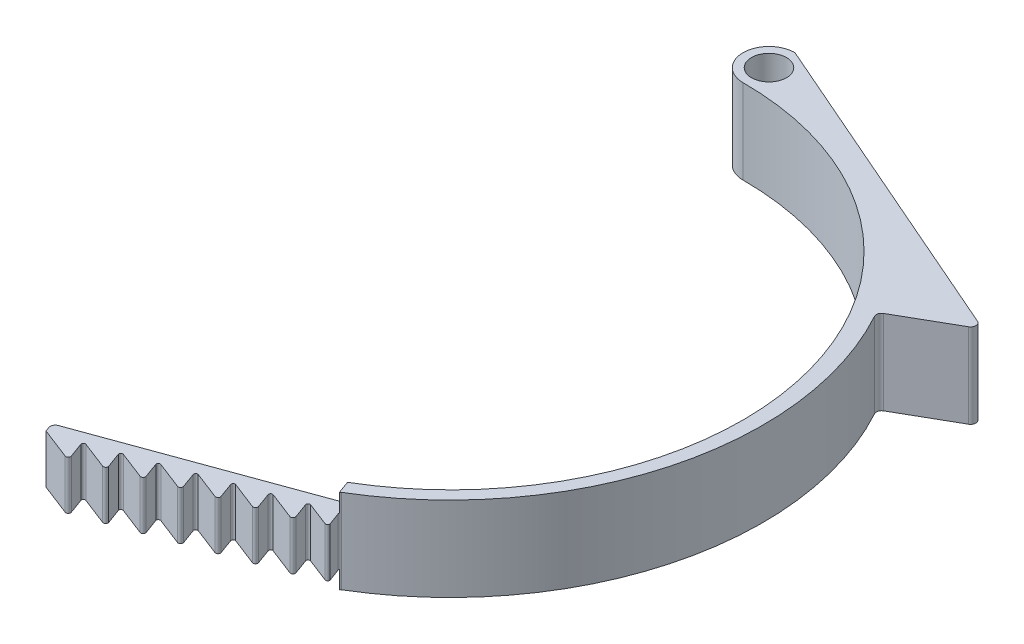
from build123d import *
from build123d.topology import SkipClean

# Parameters (mm, degrees)
BOSS_EXTRUDE1_DEPTH = 13
CUT_EXTRUDE3_DEPTH  = 77.831899265
FILLET1_R           = 0.8
LPATTERN1_DEPTH     = 13
FILLET2_R           = 0.363442
FILLET3_R           = 0.363442
FILLET4_R           = 0.363442
FILLET5_R           = 0.363442
FILLET6_R           = 0.363442
FILLET7_R           = 0.363442
FILLET8_R           = 0.363442
FILLET9_R           = 0.3
SKETCH3_OUTSIDE_W   = 148.316
SKETCH3_OUTSIDE_H   = 39.78
SKETCH3_OUTSIDE_W_2 = 5.910380326
SKETCH3_OUTSIDE_H_2 = 7.5
CUT_EXTRUDE2_DEPTH  = 35.5


# Read off the part's stored shape, not the designer's step: LPattern1
with BuildPart() as part:
    # Sketch1 → Boss-Extrude1 (new body)
    with BuildSketch(Plane(origin=(0, 0, 0), x_dir=(1, 0, 0), z_dir=(0, 1, 0))):
        with BuildLine():
            Line((0, 51.7), (0, 53))
            ThreePointArc((0, 53), (-4, 49), (0, 45))
            ThreePointArc((0, 45), (43.466662183, 11.64685703), (22.5, -38.97114317))
            Line((22.5, -38.97114317), (-10.482378388, -50.975747159))
            Line((-10.482378388, -50.975747159), (-8.772277672, -55.674210263))
            Line((-8.772277672, -55.674210263), (24.536452539, -43.550823925))
            Line((24.536452539, -43.550823925), (23.5, -40.703193978))
            ThreePointArc((23.5, -40.703193978), (45.592051892, -11.596446998), (40.913607467, 24.644050161))
            ThreePointArc((40.913607467, 24.644050161), (24.824872502, 41.52042314), (2.696847486, 48.869563675))
            ThreePointArc((2.696847486, 48.869563675), (-1.954760609, 47.137498735), (0, 51.7))
        make_face()
        with BuildLine():
            Line((51.327605208, 30.606319113), (0, 53))
            Line((0, 53), (0, 51.7))
            ThreePointArc((0, 51.7), (1.909188309, 50.909188309), (2.7, 49))
            ThreePointArc((2.7, 49), (2.699211757, 48.934762792), (2.696847486, 48.869563675))
            ThreePointArc((2.696847486, 48.869563675), (24.824872502, 41.52042314), (40.913607467, 24.644050161))
            Line((40.913607467, 24.644050161), (51.327605208, 30.606319113))
        make_face()
    extrude(amount=BOSS_EXTRUDE1_DEPTH)

    # Sketch2 → Cut-Extrude3 (cut, through all)
    with BuildSketch(Plane(origin=(0, 13, 0), x_dir=(1, 0, 0), z_dir=(0, 1, 0))):
        Polygon((-8.772277672, -55.674210263), (-9.969348173, -52.38528609), (-5.013507189, -54.30612969), align=None)
    extrude(amount=-CUT_EXTRUDE3_DEPTH, mode=Mode.SUBTRACT)

    # Fillet1
    fillet1_edges = [part.edges().sort_by_distance(p)[0] for p in [
        (51.327605208, 6.5, -30.606319113),
        (40.913607467, 6.5, -24.644050161),
        (-10.482378388, 6.5, 50.975747159),
        (0, 6.5, -53),
    ]]
    fillet(fillet1_edges, radius=FILLET1_R)

    # LPattern1 outline → LPattern1 (cut)
    with BuildSketch(Plane(origin=(0, 0, 0), x_dir=(1, 0, 0), z_dir=(0, 1, 0))):
        Polygon((-0.784890395, -52.767039045), (-5.74073138, -50.846195445), (-4.543660878, -54.135119618), align=None)
        Polygon((19.630969381, -41.611651575), (20.828039883, -44.900575748), (24.536452539, -43.550823925), (24.520414883, -43.506760826), align=None)
        Polygon((15.402352588, -43.15074222), (16.59942309, -46.439666393), (20.358193573, -45.07158582), align=None)
        Polygon((11.173735794, -44.689832865), (12.370806296, -47.978757038), (16.129576779, -46.610676465), align=None)
        Polygon((6.945119001, -46.22892351), (8.142189502, -49.517847683), (11.900959986, -48.14976711), align=None)
        Polygon((2.716502207, -47.768014155), (3.913572709, -51.056938328), (7.672343192, -49.688857755), align=None)
        Polygon((-1.512114586, -49.3071048), (-0.315044085, -52.596028973), (3.443726399, -51.2279484), align=None)
    extrude(amount=LPATTERN1_DEPTH, mode=Mode.SUBTRACT)

    # Fillet2
    fillet2_edges = [part.edges().sort_by_distance(p)[0] for p in [
        (-4.543660878, 6.5, 54.135119618),
        (-5.013507189, 6.5, 54.30612969),
    ]]
    fillet(fillet2_edges, radius=FILLET2_R)

    # Fillet3
    fillet3_edges = [part.edges().sort_by_distance(p)[0] for p in [
        (-0.315044085, 6.5, 52.596028973),
        (-0.784890395, 6.5, 52.767039045),
    ]]
    fillet(fillet3_edges, radius=FILLET3_R)

    # Fillet4
    fillet4_edges = [part.edges().sort_by_distance(p)[0] for p in [
        (3.443726399, 6.5, 51.2279484),
        (3.913572709, 6.5, 51.056938328),
    ]]
    fillet(fillet4_edges, radius=FILLET4_R)

    # Fillet5
    fillet5_edges = [part.edges().sort_by_distance(p)[0] for p in [
        (8.142189502, 6.5, 49.517847683),
        (7.672343192, 6.5, 49.688857755),
    ]]
    fillet(fillet5_edges, radius=FILLET5_R)

    # Fillet6
    fillet6_edges = [part.edges().sort_by_distance(p)[0] for p in [
        (11.900959986, 6.5, 48.14976711),
        (12.370806296, 6.5, 47.978757038),
    ]]
    fillet(fillet6_edges, radius=FILLET6_R)

    # Fillet7
    fillet7_edges = [part.edges().sort_by_distance(p)[0] for p in [
        (16.129576779, 6.5, 46.610676465),
        (16.59942309, 6.5, 46.439666393),
    ]]
    fillet(fillet7_edges, radius=FILLET7_R)

    # Fillet8
    fillet8_edges = [part.edges().sort_by_distance(p)[0] for p in [
        (20.828039883, 6.5, 44.900575748),
        (20.358193573, 6.5, 45.07158582),
    ]]
    fillet(fillet8_edges, radius=FILLET8_R)

    # Fillet9
    fillet9_edges = [part.edges().sort_by_distance(p)[0] for p in [
        (6.945119001, 6.5, 46.22892351),
        (11.173735794, 6.5, 44.689832865),
        (-1.512114586, 6.5, 49.3071048),
        (2.716502207, 6.5, 47.768014155),
        (24.520414883, 6.5, 43.506760826),
        (19.630969381, 6.5, 41.611651575),
        (15.402352588, 6.5, 43.15074222),
        (-5.74073138, 6.5, 50.846195445),
        (23.5, 6.5, 40.703193978),
    ]]
    fillet(fillet9_edges, radius=FILLET9_R)

    # Sketch3 outside → Cut-Extrude2 (cut)
    with SkipClean():  # the faces are left unmerged after this step: merging them gives an invalid solid
        with BuildSketch(Plane(origin=(-25.639462386, 0, 9.332001131), x_dir=(0.3420201433256706, 0, 0.9396926207859078), z_dir=(-0.9396926207859078, 0, 0.3420201433256706))):
            with Locations((7.46, 6.5)):
                Rectangle(SKETCH3_OUTSIDE_W, SKETCH3_OUTSIDE_H)
            with Locations((47.141631591, 6.5)):
                Rectangle(SKETCH3_OUTSIDE_W_2, SKETCH3_OUTSIDE_H_2, mode=Mode.SUBTRACT)
        extrude(amount=-CUT_EXTRUDE2_DEPTH, mode=Mode.SUBTRACT)


solid = part.part
